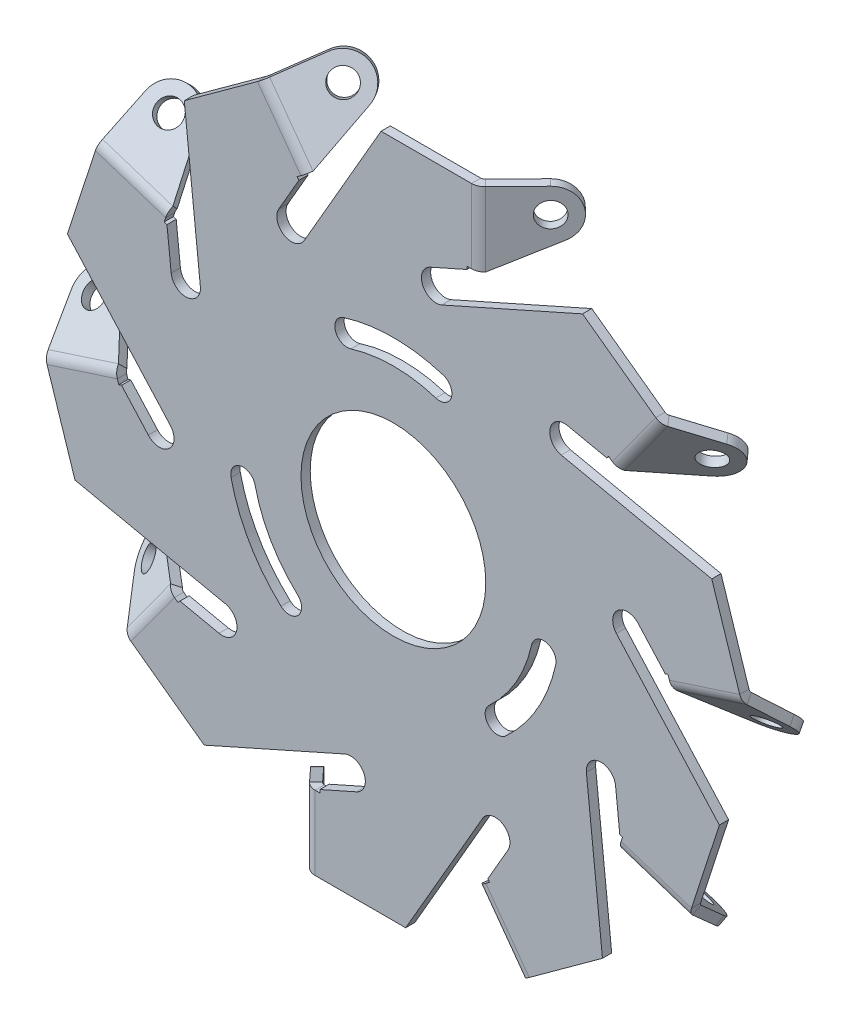
from build123d import *

# Parameters (mm, degrees)
BASE_FLANGE1_DEPTH        = 1.5
EDGE_FLANGE1_START        = -55
EDGE_FLANGE1_DEPTH        = 12
EDGE_FLANGE1_START_2      = 43
EDGE_FLANGE1_2_DEPTH      = 12
EDGE_FLANGE1_3_DEPTH      = 12
EDGE_FLANGE1_4_DEPTH      = 12
EDGE_FLANGE1_5_DEPTH      = 12
EDGE_FLANGE1_6_DEPTH      = 12
EDGE_FLANGE1_7_DEPTH      = 12
EDGE_FLANGE1_8_DEPTH      = 12
EDGE_FLANGE1_9_DEPTH      = 12
EDGE_FLANGE1_10_DEPTH     = 12
EDGE_FLANGE1_START_3      = -43
EDGE_FLANGE1_11_OUTLINE_W = 1.061152022
EDGE_FLANGE1_11_OUTLINE_H = 1.5
EDGE_FLANGE1_11_DEPTH     = 0.47245532
EDGE_FLANGE1_START_4      = 42.52754468
EDGE_FLANGE1_12_OUTLINE_W = 1.061152022
EDGE_FLANGE1_12_OUTLINE_H = 1.5
EDGE_FLANGE1_12_DEPTH     = 0.47245532
EDGE_FLANGE1_13_DEPTH     = 12
EDGE_FLANGE1_14_DEPTH     = 12
EDGE_FLANGE1_15_OUTLINE_W = 1.061152022
EDGE_FLANGE1_15_OUTLINE_H = 1.5
EDGE_FLANGE1_15_DEPTH     = 0.47245532
EDGE_FLANGE1_16_OUTLINE_W = 1.061152022
EDGE_FLANGE1_16_OUTLINE_H = 1.5
EDGE_FLANGE1_16_DEPTH     = 0.47245532
EDGE_FLANGE1_17_DEPTH     = 12
EDGE_FLANGE1_18_DEPTH     = 12
EDGE_FLANGE1_19_OUTLINE_W = 1.061152022
EDGE_FLANGE1_19_OUTLINE_H = 1.5
EDGE_FLANGE1_19_DEPTH     = 0.47245532
EDGE_FLANGE1_20_OUTLINE_W = 1.061152022
EDGE_FLANGE1_20_OUTLINE_H = 1.5
EDGE_FLANGE1_20_DEPTH     = 0.47245532
EDGE_FLANGE1_21_DEPTH     = 12
EDGE_FLANGE1_22_DEPTH     = 12
EDGE_FLANGE1_23_OUTLINE_W = 1.061152022
EDGE_FLANGE1_23_OUTLINE_H = 1.5
EDGE_FLANGE1_23_DEPTH     = 0.47245532
EDGE_FLANGE1_24_OUTLINE_W = 1.061152022
EDGE_FLANGE1_24_OUTLINE_H = 1.5
EDGE_FLANGE1_24_DEPTH     = 0.47245532
EDGE_FLANGE1_25_DEPTH     = 12
EDGE_FLANGE1_26_DEPTH     = 12
EDGE_FLANGE1_27_OUTLINE_W = 1.061152022
EDGE_FLANGE1_27_OUTLINE_H = 1.5
EDGE_FLANGE1_27_DEPTH     = 0.47245532
EDGE_FLANGE1_28_OUTLINE_W = 1.061152022
EDGE_FLANGE1_28_OUTLINE_H = 1.5
EDGE_FLANGE1_28_DEPTH     = 0.47245532
EDGE_FLANGE1_29_DEPTH     = 12
EDGE_FLANGE1_30_DEPTH     = 12
CUT_EXTRUDE1_REACH        = 91.975
SKETCH27_R                = 2
CUT_EXTRUDE2_REACH        = 85.135
SKETCH30_R                = 15
CIRPATTERN3_COUNT         = 10
CUT_EXTRUDE3_REACH        = 83.783


# Read off the part's stored shape, not the designer's step: Edge-Flange1
# Sheet-metal steps are written as plain solids
with BuildPart() as part:
    # Sketch1 → Base-Flange1 (new body)
    with BuildSketch(Plane.XY):
        with BuildLine():
            Line((13, 43), (13, 55))
            Line((13, 55), (-2, 55))
            Line((-2, 55), (-14.5, 33.349364905))
            ThreePointArc((-14.5, 33.349364905), (-17.766653662, 32.528395596), (-18.587622972, 35.795049258))
            Line((-18.587622972, 35.795049258), (-14.757544922, 42.428939038))
            Line((-14.757544922, 42.428939038), (-21.810967949, 52.13714297))
            Line((-21.810967949, 52.13714297), (-33.946222865, 43.320364186))
            Line((-33.946222865, 43.320364186), (-31.333011283, 18.457316802))
            ThreePointArc((-31.333011283, 18.457316802), (-33.493235958, 15.873047831), (-36.077504928, 18.033272506))
            Line((-36.077504928, 18.033272506), (-36.878209274, 25.65146547))
            Line((-36.878209274, 25.65146547), (-48.290887469, 29.359669402))
            Line((-48.290887469, 29.359669402), (-52.926142385, 15.093821658))
            Line((-52.926142385, 15.093821658), (-36.197877226, -3.484798979))
            ThreePointArc((-36.197877226, -3.484798979), (-36.426540511, -6.845264699), (-39.787006231, -6.616601415))
            Line((-39.787006231, -6.616601415), (-44.912651128, -0.923996046))
            Line((-44.912651128, -0.923996046), (-56.325329323, -4.632199979))
            Line((-56.325329323, -4.632199979), (-51.690074407, -18.898047723))
            Line((-51.690074407, -18.898047723), (-27.236384389, -24.095839994))
            ThreePointArc((-27.236384389, -24.095839994), (-25.446144681, -26.948918777), (-28.299223465, -28.739158485))
            Line((-28.299223465, -28.739158485), (-35.791986775, -27.146522478))
            Line((-35.791986775, -27.146522478), (-42.845409803, -36.854726411))
            Line((-42.845409803, -36.854726411), (-30.710154887, -45.671505195))
            Line((-30.710154887, -45.671505195), (-7.871518446, -35.503089118))
            ThreePointArc((-7.871518446, -35.503089118), (-4.746186466, -36.759001842), (-6.00209919, -39.884333822))
            Line((-6.00209919, -39.884333822), (-13, -43))
            Line((-13, -43), (-13, -55))
            Line((-13, -55), (2, -55))
            Line((2, -55), (14.5, -33.349364905))
            ThreePointArc((14.5, -33.349364905), (17.766653662, -32.528395596), (18.587622972, -35.795049258))
            Line((18.587622972, -35.795049258), (14.757544922, -42.428939038))
            Line((14.757544922, -42.428939038), (21.810967949, -52.13714297))
            Line((21.810967949, -52.13714297), (33.946222865, -43.320364186))
            Line((33.946222865, -43.320364186), (31.333011283, -18.457316802))
            ThreePointArc((31.333011283, -18.457316802), (33.493235958, -15.873047831), (36.077504928, -18.033272506))
            Line((36.077504928, -18.033272506), (36.878209274, -25.65146547))
            Line((36.878209274, -25.65146547), (48.290887469, -29.359669402))
            Line((48.290887469, -29.359669402), (52.926142385, -15.093821658))
            Line((52.926142385, -15.093821658), (36.197877226, 3.484798979))
            ThreePointArc((36.197877226, 3.484798979), (36.426540511, 6.845264699), (39.787006231, 6.616601415))
            Line((39.787006231, 6.616601415), (44.912651128, 0.923996046))
            Line((44.912651128, 0.923996046), (56.325329323, 4.632199979))
            Line((56.325329323, 4.632199979), (51.690074407, 18.898047723))
            Line((51.690074407, 18.898047723), (27.236384389, 24.095839994))
            ThreePointArc((27.236384389, 24.095839994), (25.446144681, 26.948918777), (28.299223465, 28.739158485))
            Line((28.299223465, 28.739158485), (35.791986775, 27.146522478))
            Line((35.791986775, 27.146522478), (42.845409803, 36.854726411))
            Line((42.845409803, 36.854726411), (30.710154887, 45.671505195))
            Line((30.710154887, 45.671505195), (7.871518446, 35.503089118))
            ThreePointArc((7.871518446, 35.503089118), (4.746186466, 36.759001842), (6.00209919, 39.884333822))
            Line((6.00209919, 39.884333822), (13, 43))
        make_face()
    extrude(amount=-BASE_FLANGE1_DEPTH)

    # Edge-Flange1 outline → Edge-Flange1 (add)
    with BuildSketch(Plane(origin=(0, 0, 0), x_dir=(0.8090169943749478, -0.5877852522924728, 0), z_dir=(0.5877852522924728, 0.8090169943749477, 0)).offset(EDGE_FLANGE1_START)):
        with BuildLine():
            Line((-13, 1.5), (-12.688847978, 1.5))
            ThreePointArc((-12.688847978, 1.5), (-12.97547668, 1.55805483), (-13.216924331, 1.723068185))
            Line((-13.216924331, 1.723068185), (-21.365981234, 10.102927292))
            Line((-21.365981234, 10.102927292), (-22.441347146, 9.057179638))
            Line((-22.441347146, 9.057179638), (-14.292290243, 0.677320531))
            ThreePointArc((-14.292290243, 0.677320531), (-13.700708273, 0.241977654), (-13, 0.02174922))
            Line((-13, 0.02174922), (-13, 1.5))
        make_face()
    extrude(amount=EDGE_FLANGE1_DEPTH)

    # Edge-Flange1 2 outline → Edge-Flange1 2 (add)
    with BuildSketch(Plane(origin=(0, 0, 0), x_dir=(0.8090169943749478, -0.5877852522924728, 0), z_dir=(0.5877852522924728, 0.8090169943749477, 0)).offset(EDGE_FLANGE1_START_2)):
        with BuildLine():
            ThreePointArc((13.216924331, 1.723068185), (12.97547668, 1.55805483), (12.688847978, 1.5))
            Line((12.688847978, 1.5), (13, 1.5))
            Line((13, 1.5), (13, 0.02174922))
            ThreePointArc((13, 0.02174922), (13.700708273, 0.241977654), (14.292290243, 0.677320531))
            Line((14.292290243, 0.677320531), (22.441347146, 9.057179638))
            Line((22.441347146, 9.057179638), (21.365981234, 10.102927292))
            Line((21.365981234, 10.102927292), (13.216924331, 1.723068185))
        make_face()
    extrude(amount=EDGE_FLANGE1_2_DEPTH)

    # Edge-Flange1 3 outline → Edge-Flange1 3 (add)
    with BuildSketch(Plane(origin=(0, 0, 0), x_dir=(-0.3090169943749482, 0.9510565162951534, 0), z_dir=(0.9510565162951534, 0.3090169943749481, 0)).offset(EDGE_FLANGE1_START)):
        with BuildLine():
            Line((13, -1.5), (12.688847978, -1.5))
            ThreePointArc((12.688847978, -1.5), (12.97547668, -1.55805483), (13.216924331, -1.723068185))
            Line((13.216924331, -1.723068185), (21.365981234, -10.102927292))
            Line((21.365981234, -10.102927292), (22.441347146, -9.057179638))
            Line((22.441347146, -9.057179638), (14.292290243, -0.677320531))
            ThreePointArc((14.292290243, -0.677320531), (13.700708273, -0.241977654), (13, -0.02174922))
            Line((13, -0.02174922), (13, -1.5))
        make_face()
    extrude(amount=EDGE_FLANGE1_3_DEPTH)

    # Edge-Flange1 4 outline → Edge-Flange1 4 (add)
    with BuildSketch(Plane(origin=(0, 0, 0), x_dir=(-0.3090169943749482, 0.9510565162951534, 0), z_dir=(0.9510565162951534, 0.3090169943749481, 0)).offset(EDGE_FLANGE1_START_2)):
        with BuildLine():
            ThreePointArc((-13.216924331, -1.723068185), (-12.97547668, -1.55805483), (-12.688847978, -1.5))
            Line((-12.688847978, -1.5), (-13, -1.5))
            Line((-13, -1.5), (-13, -0.02174922))
            ThreePointArc((-13, -0.02174922), (-13.700708273, -0.241977654), (-14.292290243, -0.677320531))
            Line((-14.292290243, -0.677320531), (-22.441347146, -9.057179638))
            Line((-22.441347146, -9.057179638), (-21.365981234, -10.102927292))
            Line((-21.365981234, -10.102927292), (-13.216924331, -1.723068185))
        make_face()
    extrude(amount=EDGE_FLANGE1_4_DEPTH)

    # Edge-Flange1 5 outline → Edge-Flange1 5 (add)
    with BuildSketch(Plane(origin=(0, 0, 0), x_dir=(0.3090169943749482, 0.9510565162951534, 0), z_dir=(0.9510565162951534, -0.3090169943749481, 0)).offset(EDGE_FLANGE1_START)):
        with BuildLine():
            Line((13, -1.5), (12.688847978, -1.5))
            ThreePointArc((12.688847978, -1.5), (12.97547668, -1.55805483), (13.216924331, -1.723068185))
            Line((13.216924331, -1.723068185), (21.365981234, -10.102927292))
            Line((21.365981234, -10.102927292), (22.441347146, -9.057179638))
            Line((22.441347146, -9.057179638), (14.292290243, -0.677320531))
            ThreePointArc((14.292290243, -0.677320531), (13.700708273, -0.241977654), (13, -0.02174922))
            Line((13, -0.02174922), (13, -1.5))
        make_face()
    extrude(amount=EDGE_FLANGE1_5_DEPTH)

    # Edge-Flange1 6 outline → Edge-Flange1 6 (add)
    with BuildSketch(Plane(origin=(0, 0, 0), x_dir=(0.3090169943749482, 0.9510565162951534, 0), z_dir=(0.9510565162951534, -0.3090169943749481, 0)).offset(EDGE_FLANGE1_START_2)):
        with BuildLine():
            ThreePointArc((-13.216924331, -1.723068185), (-12.97547668, -1.55805483), (-12.688847978, -1.5))
            Line((-12.688847978, -1.5), (-13, -1.5))
            Line((-13, -1.5), (-13, -0.02174922))
            ThreePointArc((-13, -0.02174922), (-13.700708273, -0.241977654), (-14.292290243, -0.677320531))
            Line((-14.292290243, -0.677320531), (-22.441347146, -9.057179638))
            Line((-22.441347146, -9.057179638), (-21.365981234, -10.102927292))
            Line((-21.365981234, -10.102927292), (-13.216924331, -1.723068185))
        make_face()
    extrude(amount=EDGE_FLANGE1_6_DEPTH)

    # Edge-Flange1 7 outline → Edge-Flange1 7 (add)
    with BuildSketch(Plane(origin=(0, 0, 0), x_dir=(0.8090169943749472, 0.5877852522924732, 0), z_dir=(0.5877852522924732, -0.8090169943749473, 0)).offset(EDGE_FLANGE1_START)):
        with BuildLine():
            Line((13, -1.5), (12.688847978, -1.5))
            ThreePointArc((12.688847978, -1.5), (12.97547668, -1.55805483), (13.216924331, -1.723068185))
            Line((13.216924331, -1.723068185), (21.365981234, -10.102927292))
            Line((21.365981234, -10.102927292), (22.441347146, -9.057179638))
            Line((22.441347146, -9.057179638), (14.292290243, -0.677320531))
            ThreePointArc((14.292290243, -0.677320531), (13.700708273, -0.241977654), (13, -0.02174922))
            Line((13, -0.02174922), (13, -1.5))
        make_face()
    extrude(amount=EDGE_FLANGE1_7_DEPTH)

    # Edge-Flange1 8 outline → Edge-Flange1 8 (add)
    with BuildSketch(Plane(origin=(0, 0, 0), x_dir=(0.8090169943749472, 0.5877852522924732, 0), z_dir=(0.5877852522924732, -0.8090169943749473, 0)).offset(EDGE_FLANGE1_START_2)):
        with BuildLine():
            ThreePointArc((-13.216924331, -1.723068185), (-12.97547668, -1.55805483), (-12.688847978, -1.5))
            Line((-12.688847978, -1.5), (-13, -1.5))
            Line((-13, -1.5), (-13, -0.02174922))
            ThreePointArc((-13, -0.02174922), (-13.700708273, -0.241977654), (-14.292290243, -0.677320531))
            Line((-14.292290243, -0.677320531), (-22.441347146, -9.057179638))
            Line((-22.441347146, -9.057179638), (-21.365981234, -10.102927292))
            Line((-21.365981234, -10.102927292), (-13.216924331, -1.723068185))
        make_face()
    extrude(amount=EDGE_FLANGE1_8_DEPTH)

    # Edge-Flange1 9 outline → Edge-Flange1 9 (add)
    with BuildSketch(Plane(origin=(0, 0, 0), x_dir=(1, 0, 0), z_dir=(0, 1, 0)).offset(EDGE_FLANGE1_START)):
        with BuildLine():
            Line((-13, 1.5), (-12.688847978, 1.5))
            ThreePointArc((-12.688847978, 1.5), (-12.97547668, 1.55805483), (-13.216924331, 1.723068185))
            Line((-13.216924331, 1.723068185), (-21.365981234, 10.102927292))
            Line((-21.365981234, 10.102927292), (-22.441347146, 9.057179638))
            Line((-22.441347146, 9.057179638), (-14.292290243, 0.677320531))
            ThreePointArc((-14.292290243, 0.677320531), (-13.700708273, 0.241977654), (-13, 0.02174922))
            Line((-13, 0.02174922), (-13, 1.5))
        make_face()
    extrude(amount=EDGE_FLANGE1_9_DEPTH)

    # Edge-Flange1 10 outline → Edge-Flange1 10 (add)
    with BuildSketch(Plane(origin=(0, 0, 0), x_dir=(1, 0, 0), z_dir=(0, 1, 0)).offset(EDGE_FLANGE1_START_2)):
        with BuildLine():
            ThreePointArc((13.216924331, 1.723068185), (12.97547668, 1.55805483), (12.688847978, 1.5))
            Line((12.688847978, 1.5), (13, 1.5))
            Line((13, 1.5), (13, 0.02174922))
            ThreePointArc((13, 0.02174922), (13.700708273, 0.241977654), (14.292290243, 0.677320531))
            Line((14.292290243, 0.677320531), (22.441347146, 9.057179638))
            Line((22.441347146, 9.057179638), (21.365981234, 10.102927292))
            Line((21.365981234, 10.102927292), (13.216924331, 1.723068185))
        make_face()
    extrude(amount=EDGE_FLANGE1_10_DEPTH)

    # Edge-Flange1 11 outline → Edge-Flange1 11 (cut)
    with BuildSketch(Plane(origin=(0, 0, 0), x_dir=(0.8090169943749478, -0.5877852522924728, 0), z_dir=(0.5877852522924728, 0.8090169943749477, 0)).offset(EDGE_FLANGE1_START_3)):
        with Locations((-12.469423989, 0.75)):
            Rectangle(EDGE_FLANGE1_11_OUTLINE_W, EDGE_FLANGE1_11_OUTLINE_H)
    extrude(amount=EDGE_FLANGE1_11_DEPTH, mode=Mode.SUBTRACT)

    # Edge-Flange1 12 outline → Edge-Flange1 12 (cut)
    with BuildSketch(Plane(origin=(0, 0, 0), x_dir=(0.8090169943749478, -0.5877852522924728, 0), z_dir=(0.5877852522924728, 0.8090169943749477, 0)).offset(EDGE_FLANGE1_START_4)):
        with Locations((12.469423989, 0.75)):
            Rectangle(EDGE_FLANGE1_12_OUTLINE_W, EDGE_FLANGE1_12_OUTLINE_H)
    extrude(amount=EDGE_FLANGE1_12_DEPTH, mode=Mode.SUBTRACT)

    # Edge-Flange1 13 outline → Edge-Flange1 13 (cut)
    with BuildSketch(Plane(origin=(0, 0, 0), x_dir=(0.8090169943749478, -0.5877852522924728, 0), z_dir=(0.5877852522924728, 0.8090169943749477, 0)).offset(EDGE_FLANGE1_START)):
        with BuildLine():
            Line((-13, 0), (-12.688847978, 0))
            ThreePointArc((-12.688847978, 0), (-12.844803588, 0.00544393), (-13, 0.02174922))
            Line((-13, 0.02174922), (-13, 0))
        make_face()
    extrude(amount=EDGE_FLANGE1_13_DEPTH, mode=Mode.SUBTRACT)

    # Edge-Flange1 14 outline → Edge-Flange1 14 (cut)
    with BuildSketch(Plane(origin=(0, 0, 0), x_dir=(0.8090169943749478, -0.5877852522924728, 0), z_dir=(0.5877852522924728, 0.8090169943749477, 0)).offset(EDGE_FLANGE1_START_2)):
        with BuildLine():
            ThreePointArc((13, 0.02174922), (12.844803588, 0.00544393), (12.688847978, 0))
            Line((12.688847978, 0), (13, 0))
            Line((13, 0), (13, 0.02174922))
        make_face()
    extrude(amount=EDGE_FLANGE1_14_DEPTH, mode=Mode.SUBTRACT)

    # Edge-Flange1 15 outline → Edge-Flange1 15 (cut)
    with BuildSketch(Plane(origin=(0, 0, 0), x_dir=(-0.3090169943749482, 0.9510565162951534, 0), z_dir=(0.9510565162951534, 0.3090169943749481, 0)).offset(EDGE_FLANGE1_START_3)):
        with Locations((12.469423989, -0.75)):
            Rectangle(EDGE_FLANGE1_15_OUTLINE_W, EDGE_FLANGE1_15_OUTLINE_H)
    extrude(amount=EDGE_FLANGE1_15_DEPTH, mode=Mode.SUBTRACT)

    # Edge-Flange1 16 outline → Edge-Flange1 16 (cut)
    with BuildSketch(Plane(origin=(0, 0, 0), x_dir=(-0.3090169943749482, 0.9510565162951534, 0), z_dir=(0.9510565162951534, 0.3090169943749481, 0)).offset(EDGE_FLANGE1_START_4)):
        with Locations((-12.469423989, -0.75)):
            Rectangle(EDGE_FLANGE1_16_OUTLINE_W, EDGE_FLANGE1_16_OUTLINE_H)
    extrude(amount=EDGE_FLANGE1_16_DEPTH, mode=Mode.SUBTRACT)

    # Edge-Flange1 17 outline → Edge-Flange1 17 (cut)
    with BuildSketch(Plane(origin=(0, 0, 0), x_dir=(-0.3090169943749482, 0.9510565162951534, 0), z_dir=(0.9510565162951534, 0.3090169943749481, 0)).offset(EDGE_FLANGE1_START)):
        with BuildLine():
            Line((13, 0), (12.688847978, 0))
            ThreePointArc((12.688847978, 0), (12.844803588, -0.00544393), (13, -0.02174922))
            Line((13, -0.02174922), (13, 0))
        make_face()
    extrude(amount=EDGE_FLANGE1_17_DEPTH, mode=Mode.SUBTRACT)

    # Edge-Flange1 18 outline → Edge-Flange1 18 (cut)
    with BuildSketch(Plane(origin=(0, 0, 0), x_dir=(-0.3090169943749482, 0.9510565162951534, 0), z_dir=(0.9510565162951534, 0.3090169943749481, 0)).offset(EDGE_FLANGE1_START_2)):
        with BuildLine():
            ThreePointArc((-13, -0.02174922), (-12.844803588, -0.00544393), (-12.688847978, 0))
            Line((-12.688847978, 0), (-13, 0))
            Line((-13, 0), (-13, -0.02174922))
        make_face()
    extrude(amount=EDGE_FLANGE1_18_DEPTH, mode=Mode.SUBTRACT)

    # Edge-Flange1 19 outline → Edge-Flange1 19 (cut)
    with BuildSketch(Plane(origin=(0, 0, 0), x_dir=(0.3090169943749482, 0.9510565162951534, 0), z_dir=(0.9510565162951534, -0.3090169943749481, 0)).offset(EDGE_FLANGE1_START_3)):
        with Locations((12.469423989, -0.75)):
            Rectangle(EDGE_FLANGE1_19_OUTLINE_W, EDGE_FLANGE1_19_OUTLINE_H)
    extrude(amount=EDGE_FLANGE1_19_DEPTH, mode=Mode.SUBTRACT)

    # Edge-Flange1 20 outline → Edge-Flange1 20 (cut)
    with BuildSketch(Plane(origin=(0, 0, 0), x_dir=(0.3090169943749482, 0.9510565162951534, 0), z_dir=(0.9510565162951534, -0.3090169943749481, 0)).offset(EDGE_FLANGE1_START_4)):
        with Locations((-12.469423989, -0.75)):
            Rectangle(EDGE_FLANGE1_20_OUTLINE_W, EDGE_FLANGE1_20_OUTLINE_H)
    extrude(amount=EDGE_FLANGE1_20_DEPTH, mode=Mode.SUBTRACT)

    # Edge-Flange1 21 outline → Edge-Flange1 21 (cut)
    with BuildSketch(Plane(origin=(0, 0, 0), x_dir=(0.3090169943749482, 0.9510565162951534, 0), z_dir=(0.9510565162951534, -0.3090169943749481, 0)).offset(EDGE_FLANGE1_START)):
        with BuildLine():
            Line((13, 0), (12.688847978, 0))
            ThreePointArc((12.688847978, 0), (12.844803588, -0.00544393), (13, -0.02174922))
            Line((13, -0.02174922), (13, 0))
        make_face()
    extrude(amount=EDGE_FLANGE1_21_DEPTH, mode=Mode.SUBTRACT)

    # Edge-Flange1 22 outline → Edge-Flange1 22 (cut)
    with BuildSketch(Plane(origin=(0, 0, 0), x_dir=(0.3090169943749482, 0.9510565162951534, 0), z_dir=(0.9510565162951534, -0.3090169943749481, 0)).offset(EDGE_FLANGE1_START_2)):
        with BuildLine():
            ThreePointArc((-13, -0.02174922), (-12.844803588, -0.00544393), (-12.688847978, 0))
            Line((-12.688847978, 0), (-13, 0))
            Line((-13, 0), (-13, -0.02174922))
        make_face()
    extrude(amount=EDGE_FLANGE1_22_DEPTH, mode=Mode.SUBTRACT)

    # Edge-Flange1 23 outline → Edge-Flange1 23 (cut)
    with BuildSketch(Plane(origin=(0, 0, 0), x_dir=(0.8090169943749472, 0.5877852522924732, 0), z_dir=(0.5877852522924732, -0.8090169943749473, 0)).offset(EDGE_FLANGE1_START_3)):
        with Locations((12.469423989, -0.75)):
            Rectangle(EDGE_FLANGE1_23_OUTLINE_W, EDGE_FLANGE1_23_OUTLINE_H)
    extrude(amount=EDGE_FLANGE1_23_DEPTH, mode=Mode.SUBTRACT)

    # Edge-Flange1 24 outline → Edge-Flange1 24 (cut)
    with BuildSketch(Plane(origin=(0, 0, 0), x_dir=(0.8090169943749472, 0.5877852522924732, 0), z_dir=(0.5877852522924732, -0.8090169943749473, 0)).offset(EDGE_FLANGE1_START_4)):
        with Locations((-12.469423989, -0.75)):
            Rectangle(EDGE_FLANGE1_24_OUTLINE_W, EDGE_FLANGE1_24_OUTLINE_H)
    extrude(amount=EDGE_FLANGE1_24_DEPTH, mode=Mode.SUBTRACT)

    # Edge-Flange1 25 outline → Edge-Flange1 25 (cut)
    with BuildSketch(Plane(origin=(0, 0, 0), x_dir=(0.8090169943749472, 0.5877852522924732, 0), z_dir=(0.5877852522924732, -0.8090169943749473, 0)).offset(EDGE_FLANGE1_START)):
        with BuildLine():
            Line((13, 0), (12.688847978, 0))
            ThreePointArc((12.688847978, 0), (12.844803588, -0.00544393), (13, -0.02174922))
            Line((13, -0.02174922), (13, 0))
        make_face()
    extrude(amount=EDGE_FLANGE1_25_DEPTH, mode=Mode.SUBTRACT)

    # Edge-Flange1 26 outline → Edge-Flange1 26 (cut)
    with BuildSketch(Plane(origin=(0, 0, 0), x_dir=(0.8090169943749472, 0.5877852522924732, 0), z_dir=(0.5877852522924732, -0.8090169943749473, 0)).offset(EDGE_FLANGE1_START_2)):
        with BuildLine():
            ThreePointArc((-13, -0.02174922), (-12.844803588, -0.00544393), (-12.688847978, 0))
            Line((-12.688847978, 0), (-13, 0))
            Line((-13, 0), (-13, -0.02174922))
        make_face()
    extrude(amount=EDGE_FLANGE1_26_DEPTH, mode=Mode.SUBTRACT)

    # Edge-Flange1 27 outline → Edge-Flange1 27 (cut)
    with BuildSketch(Plane(origin=(0, 0, 0), x_dir=(1, 0, 0), z_dir=(0, 1, 0)).offset(EDGE_FLANGE1_START_3)):
        with Locations((-12.469423989, 0.75)):
            Rectangle(EDGE_FLANGE1_27_OUTLINE_W, EDGE_FLANGE1_27_OUTLINE_H)
    extrude(amount=EDGE_FLANGE1_27_DEPTH, mode=Mode.SUBTRACT)

    # Edge-Flange1 28 outline → Edge-Flange1 28 (cut)
    with BuildSketch(Plane(origin=(0, 0, 0), x_dir=(1, 0, 0), z_dir=(0, 1, 0)).offset(EDGE_FLANGE1_START_4)):
        with Locations((12.469423989, 0.75)):
            Rectangle(EDGE_FLANGE1_28_OUTLINE_W, EDGE_FLANGE1_28_OUTLINE_H)
    extrude(amount=EDGE_FLANGE1_28_DEPTH, mode=Mode.SUBTRACT)

    # Edge-Flange1 29 outline → Edge-Flange1 29 (cut)
    with BuildSketch(Plane(origin=(0, 0, 0), x_dir=(1, 0, 0), z_dir=(0, 1, 0)).offset(EDGE_FLANGE1_START)):
        with BuildLine():
            Line((-13, 0), (-12.688847978, 0))
            ThreePointArc((-12.688847978, 0), (-12.844803588, 0.00544393), (-13, 0.02174922))
            Line((-13, 0.02174922), (-13, 0))
        make_face()
    extrude(amount=EDGE_FLANGE1_29_DEPTH, mode=Mode.SUBTRACT)

    # Edge-Flange1 30 outline → Edge-Flange1 30 (cut)
    with BuildSketch(Plane(origin=(0, 0, 0), x_dir=(1, 0, 0), z_dir=(0, 1, 0)).offset(EDGE_FLANGE1_START_2)):
        with BuildLine():
            ThreePointArc((13, 0.02174922), (12.844803588, 0.00544393), (12.688847978, 0))
            Line((12.688847978, 0), (13, 0))
            Line((13, 0), (13, 0.02174922))
        make_face()
    extrude(amount=EDGE_FLANGE1_30_DEPTH, mode=Mode.SUBTRACT)

    # Sketch27 → Cut-Extrude1 (cut, up to next)
    with BuildSketch(Plane(origin=(4.798913307, 3.486614606, 5.768406977), x_dir=(-0.8146011630626458, 0.2939573728089795, 0.5000140079120059), z_dir=(-0.5799928650369075, -0.42138948238898727, -0.6971651028545686)), mode=Mode.PRIVATE) as cut_extrude1_sk1:
        with Locations(Location((24.048450979, 48.413379545, 0), (0, 0, 341.086428441))):
            Circle(SKETCH27_R)
    cut_extrude1_tool1 = extrude(cut_extrude1_sk1.sketch, amount=-CUT_EXTRUDE1_REACH, mode=Mode.PRIVATE) & part.part
    # Sketch27 → Cut-Extrude1 (cut, up to next)
    with BuildSketch(Plane(origin=(4.798913307, 3.486614606, 5.768406977), x_dir=(-0.8146011630626458, 0.2939573728089795, 0.5000140079120059), z_dir=(-0.5799928650369075, -0.42138948238898727, -0.6971651028545686)), mode=Mode.PRIVATE) as cut_extrude1_sk2:
        with BuildLine():
            Line((23.526776676, 37.479144369), (20.259635908, 47.130850652))
            ThreePointArc((20.259635908, 47.130850652), (21.960705407, 51.82531718), (26.91495922, 51.203205795))
            Line((26.91495922, 51.203205795), (23.973837672, 54.225167882))
            Line((23.973837672, 54.225167882), (15.374312948, 45.855689134))
            Line((15.374312948, 45.855689134), (23.526776676, 37.479144369))
        make_face()
    cut_extrude1_tool2 = extrude(cut_extrude1_sk2.sketch, amount=-CUT_EXTRUDE1_REACH, mode=Mode.PRIVATE) & part.part
    cut_extrude1_1 = cut_extrude1_tool1.solids().sort_by_distance((-15.070029, 52.09045, -7.07977))[0]
    add(cut_extrude1_1, mode=Mode.SUBTRACT)
    cut_extrude1_2 = cut_extrude1_tool2.solids().sort_by_distance((-11.708666, 48.409312, -7.651189))[0]
    add(cut_extrude1_2, mode=Mode.SUBTRACT)
    cut_extrude1 = cut_extrude1_1 + cut_extrude1_2  # Cut-Extrude1 as one shape, for the pattern or mirror that repeats it

    # Sketch30 → Cut-Extrude2 (cut, up to next)
    with BuildSketch(Plane(origin=(0, 0, -1.5), x_dir=(-1, 0, 0), z_dir=(0, 0, -1)), mode=Mode.PRIVATE) as cut_extrude2_sk1:
        Circle(SKETCH30_R)
    cut_extrude2_tool1 = extrude(cut_extrude2_sk1.sketch, amount=-CUT_EXTRUDE2_REACH, mode=Mode.PRIVATE) & part.part
    add(cut_extrude2_tool1.solids().sort_by_distance((0, 0, -1.5))[0], mode=Mode.SUBTRACT)

    # CirPattern3: Cut-Extrude1 ×10 about axis
    cirpattern3_axis = Axis((0, 0, 0), (0, 0, 1))
    for i in range(1, CIRPATTERN3_COUNT):
        add(cut_extrude1.rotate(cirpattern3_axis, i * 360 / CIRPATTERN3_COUNT), mode=Mode.SUBTRACT)

    # Sketch31 → Cut-Extrude3 (cut, up to next)
    with BuildSketch(Plane.XY, mode=Mode.PRIVATE) as cut_extrude3_sk1:
        with BuildLine():
            ThreePointArc((8.1, 25.756358438), (0, 27), (-8.1, 25.756358438))
            ThreePointArc((-8.1, 25.756358438), (-9.407878403, 23.248480035), (-6.9, 21.940601633))
            ThreePointArc((-6.9, 21.940601633), (0, 23), (6.9, 21.940601633))
            ThreePointArc((6.9, 21.940601633), (9.407878403, 23.248480035), (8.1, 25.756358438))
        make_face()
    cut_extrude3_tool1 = extrude(cut_extrude3_sk1.sketch, amount=-CUT_EXTRUDE3_REACH, mode=Mode.PRIVATE) & part.part
    # Sketch31 → Cut-Extrude3 (cut, up to next)
    with BuildSketch(Plane.XY, mode=Mode.PRIVATE) as cut_extrude3_sk2:
        with BuildLine():
            ThreePointArc((18.255660717, -19.89298499), (23.382685902, -13.5), (26.355660717, -5.863373448))
            ThreePointArc((26.355660717, -5.863373448), (24.837713511, -3.476778325), (22.451118388, -4.99472553))
            ThreePointArc((22.451118388, -4.99472553), (19.918584287, -11.5), (15.551118388, -16.945876102))
            ThreePointArc((15.551118388, -16.945876102), (15.429835109, -19.77170171), (18.255660717, -19.89298499))
        make_face()
    cut_extrude3_tool2 = extrude(cut_extrude3_sk2.sketch, amount=-CUT_EXTRUDE3_REACH, mode=Mode.PRIVATE) & part.part
    # Sketch31 → Cut-Extrude3 (cut, up to next)
    with BuildSketch(Plane.XY, mode=Mode.PRIVATE) as cut_extrude3_sk3:
        with BuildLine():
            ThreePointArc((-26.355660717, -5.863373448), (-23.382685902, -13.5), (-18.255660717, -19.89298499))
            ThreePointArc((-18.255660717, -19.89298499), (-15.429835109, -19.77170171), (-15.551118388, -16.945876102))
            ThreePointArc((-15.551118388, -16.945876102), (-19.918584287, -11.5), (-22.451118388, -4.99472553))
            ThreePointArc((-22.451118388, -4.99472553), (-24.837713511, -3.476778325), (-26.355660717, -5.863373448))
        make_face()
    cut_extrude3_tool3 = extrude(cut_extrude3_sk3.sketch, amount=-CUT_EXTRUDE3_REACH, mode=Mode.PRIVATE) & part.part
    add(cut_extrude3_tool1.solids().sort_by_distance((0, 24.48393, 0))[0], mode=Mode.SUBTRACT)
    add(cut_extrude3_tool2.solids().sort_by_distance((21.203705, -12.241965, 0))[0], mode=Mode.SUBTRACT)
    add(cut_extrude3_tool3.solids().sort_by_distance((-21.203705, -12.241965, 0))[0], mode=Mode.SUBTRACT)


solid = part.part
